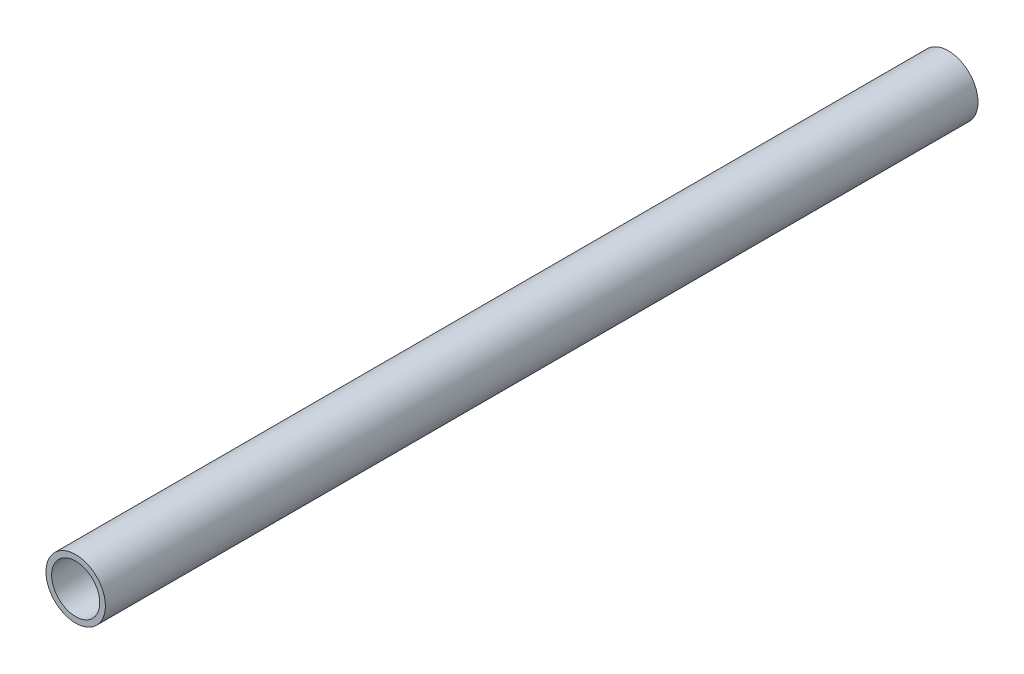
from build123d import *

# Parameters (mm, degrees)
SKETCH1_R           = 8.001
SKETCH1_R_2         = 6.477
BOSS_EXTRUDE1_DEPTH = 234.95


with BuildPart() as part:
    # Sketch1 → Boss-Extrude1 (new body)
    with BuildSketch(Plane.XY):
        Circle(SKETCH1_R)
        Circle(SKETCH1_R_2, mode=Mode.SUBTRACT)
    extrude(amount=BOSS_EXTRUDE1_DEPTH)


solid = part.part
